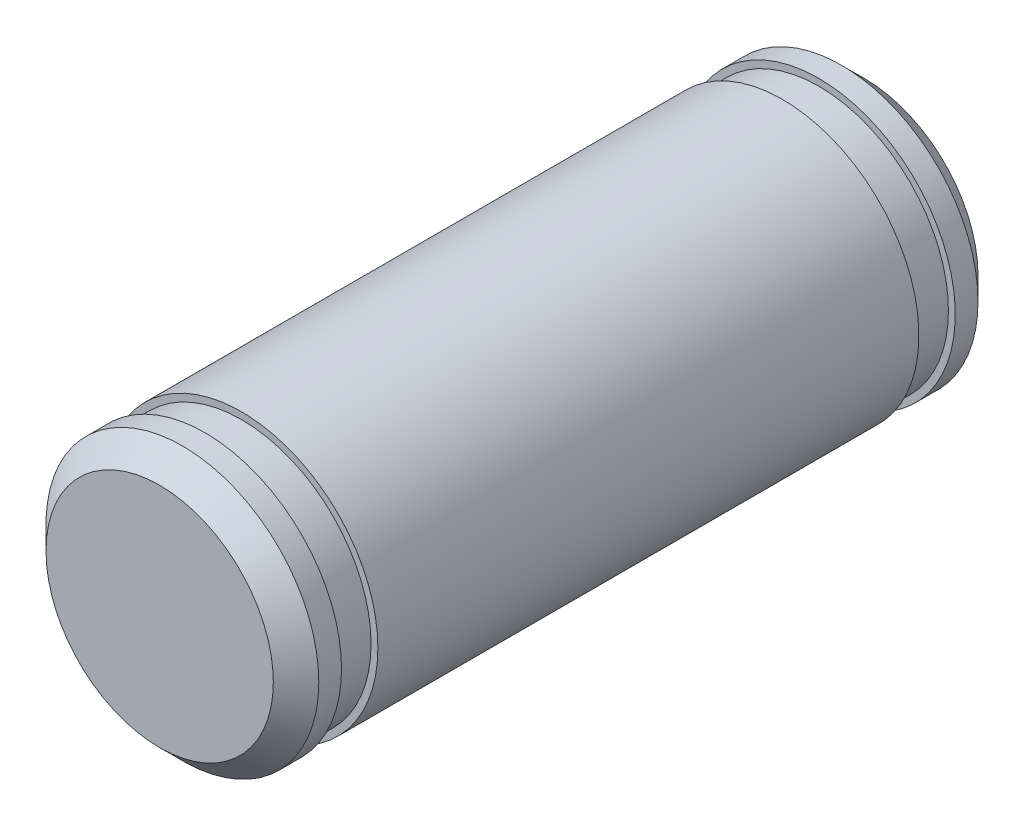
from build123d import *

# Parameters (mm, degrees)
SZKIC1_R                    = 3
DODANIE_WYCI_GNI_CIE1_DEPTH = 15.5
SFAZOWANIE1_SIZE            = 0.5
WYTNIJ_WYCI_GNI_CIE1_START  = -1.8
SZKIC2_R                    = 3
SZKIC2_R_2                  = 2.85
WYTNIJ_WYCI_GNI_CIE1_DEPTH  = 0.8
WYTNIJ_WYCI_GNI_CIE2_START  = -1
SZKIC3_R                    = 3
SZKIC3_R_2                  = 2.85
WYTNIJ_WYCI_GNI_CIE2_DEPTH  = 0.8


with BuildPart() as part:
    # Szkic1 → Dodanie-wyciągnięcie1 (new body)
    with BuildSketch(Plane.XY):
        Circle(SZKIC1_R)
    extrude(amount=DODANIE_WYCI_GNI_CIE1_DEPTH)

    # Sfazowanie1
    sfazowanie1_edges = [part.edges().sort_by_distance(p)[0] for p in [
        (-3, 0, 0),
        (-3, 0, 15.5),
    ]]
    chamfer(sfazowanie1_edges, length=SFAZOWANIE1_SIZE)

    # Szkic2 → Wytnij-wyciągnięcie1 (cut)
    with BuildSketch(Plane.XY.offset(15.5).offset(WYTNIJ_WYCI_GNI_CIE1_START)):
        Circle(SZKIC2_R)
        Circle(SZKIC2_R_2, mode=Mode.SUBTRACT)
    extrude(amount=WYTNIJ_WYCI_GNI_CIE1_DEPTH, mode=Mode.SUBTRACT)

    # Szkic3 → Wytnij-wyciągnięcie2 (cut)
    with BuildSketch(Plane(origin=(0, 0, 0), x_dir=(-1, 0, 0), z_dir=(0, 0, -1)).offset(WYTNIJ_WYCI_GNI_CIE2_START)):
        Circle(SZKIC3_R)
        Circle(SZKIC3_R_2, mode=Mode.SUBTRACT)
    extrude(amount=-WYTNIJ_WYCI_GNI_CIE2_DEPTH, mode=Mode.SUBTRACT)


solid = part.part
